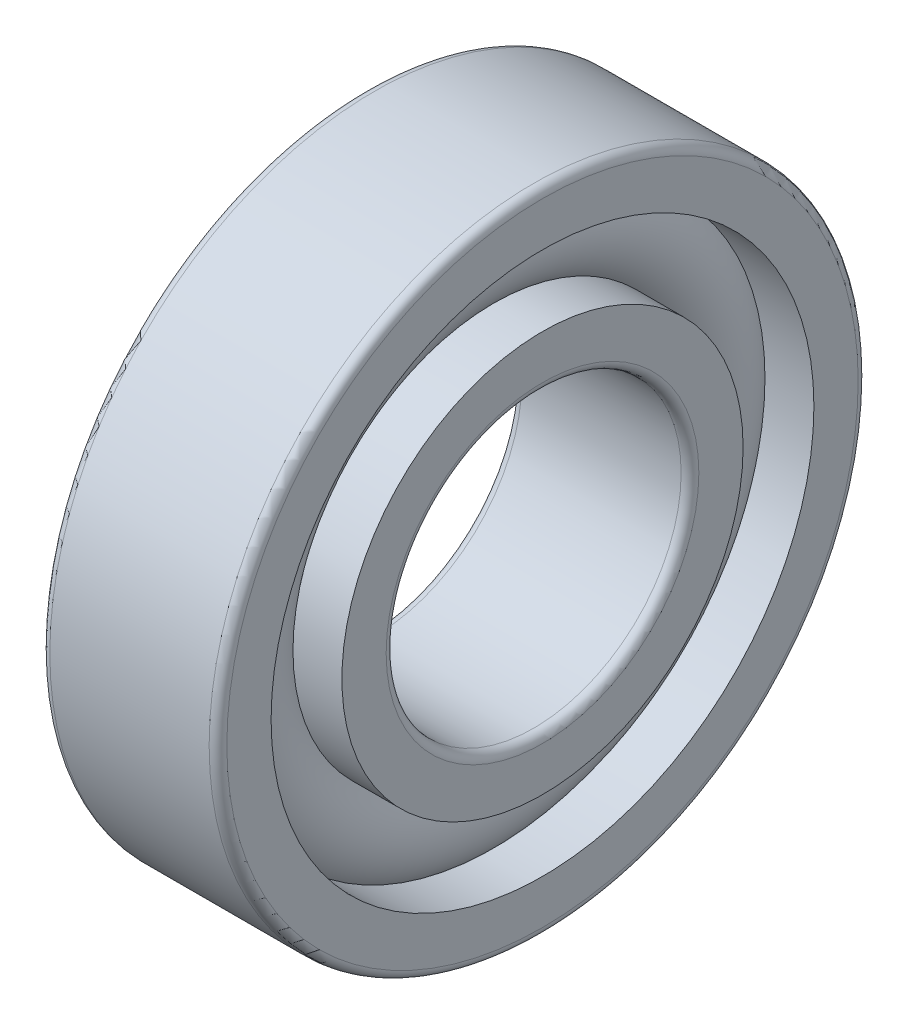
from build123d import *

# Parameters (mm, degrees)
CAGSPISKE_W     = 0.36
CAGSPISKE_H     = 0.6
CAGESPINE_ANGLE = 0.001
BALSIMSKE_R     = 1.8


with BuildPart() as part:
    # CagSpiSke → CageSpine (revolve)
    with BuildSketch(Plane.XY):
        with Locations((0, 8)):
            Rectangle(CAGSPISKE_W, CAGSPISKE_H)
    revolve(axis=Axis((-20.6375, 0, 0), (-1, 0, 0)), revolution_arc=CAGESPINE_ANGLE)

    # BalSimSke → BallsSimplified (revolve)
    with BuildSketch(Plane.XY):
        with Locations((0, 8)):
            Circle(BALSIMSKE_R)
    revolve(axis=Axis((-10, 0, 0), (1, 0, 0)))

    # InnRacSke → InnerRace (revolve)
    with BuildSketch(Plane.XY):
        with BuildLine():
            Line((-1.307908636, 6.8), (-3, 6.8))
            Line((-3, 6.8), (-3, 5.3))
            ThreePointArc((-3, 5.3), (-2.912132034, 5.087867966), (-2.7, 5))
            Line((-2.7, 5), (2.7, 5))
            ThreePointArc((2.7, 5), (2.912132034, 5.087867966), (3, 5.3))
            Line((3, 5.3), (3, 6.8))
            Line((3, 6.8), (1.307908636, 6.8))
            ThreePointArc((1.307908636, 6.8), (0, 6.225), (-1.307908636, 6.8))
        make_face()
    revolve(axis=Axis((-20.6375, 0, 0), (1, 0, 0)))

    # OutRacSke → OuterRace (revolve)
    with BuildSketch(Plane.XY):
        with BuildLine():
            Line((-1.307908636, 9.2), (-3, 9.2))
            Line((-3, 9.2), (-3, 10.7))
            ThreePointArc((-3, 10.7), (-2.912132034, 10.912132034), (-2.7, 11))
            Line((-2.7, 11), (2.7, 11))
            ThreePointArc((2.7, 11), (2.912132034, 10.912132034), (3, 10.7))
            Line((3, 10.7), (3, 9.2))
            Line((3, 9.2), (1.307908636, 9.2))
            ThreePointArc((1.307908636, 9.2), (0, 9.775), (-1.307908636, 9.2))
        make_face()
    revolve(axis=Axis((-20.6375, 0, 0), (1, 0, 0)))


solid = part.part
